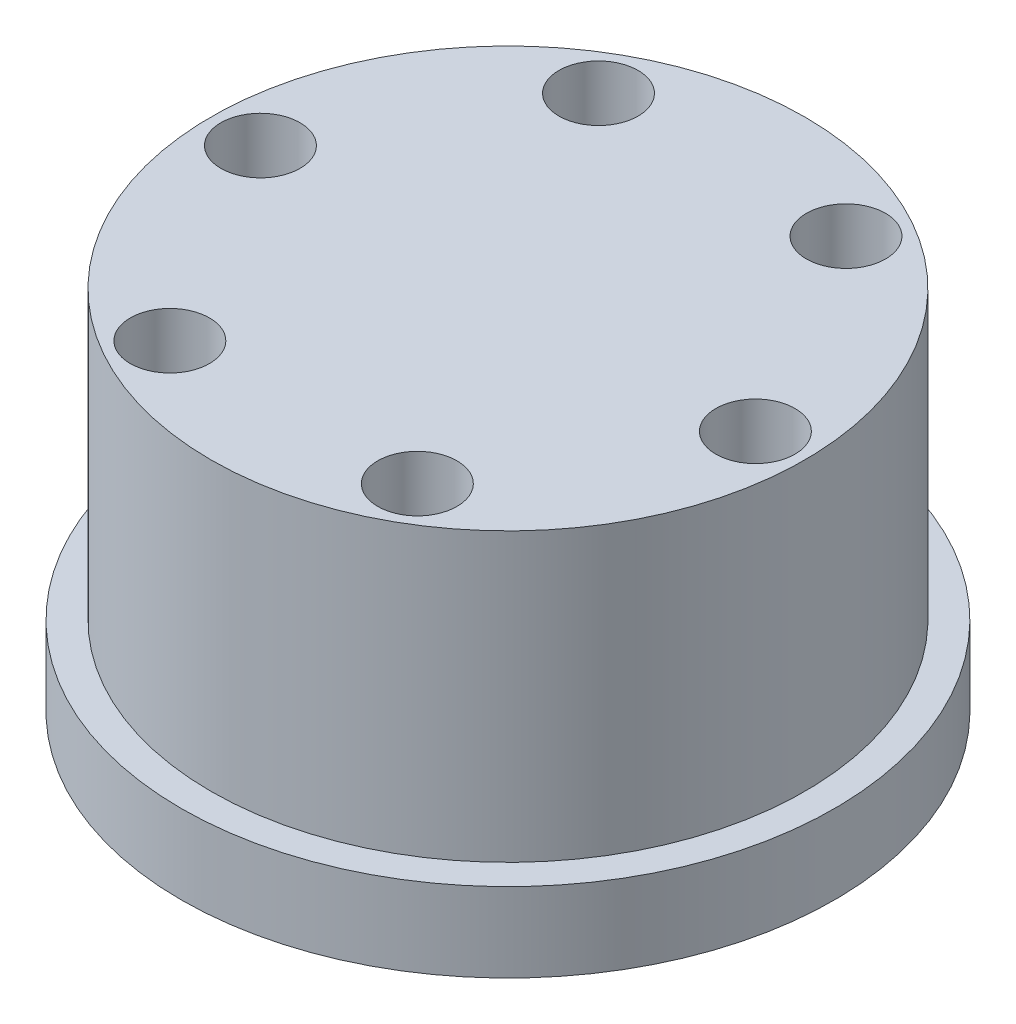
from build123d import *

# Parameters (mm, degrees)
SKETCH1_R           = 16.5
SKETCH1_R_2         = 1.5
BOSS_EXTRUDE1_DEPTH = 4
SKETCH2_R           = 15
BOSS_EXTRUDE2_DEPTH = 14.5
SKETCH5_R           = 2
CUT_EXTRUDE3_DEPTH  = 6.5
SKETCH6_R           = 7.5
CUT_EXTRUDE4_DEPTH  = 5


with BuildPart() as part:
    # Sketch1 → Boss-Extrude1 (new body)
    with BuildSketch(Plane(origin=(0, 0, 0), x_dir=(1, 0, 0), z_dir=(0, 1, 0))):
        Circle(SKETCH1_R)
        with Locations((0, 12.5)):
            Circle(SKETCH1_R_2, mode=Mode.SUBTRACT)
        with Locations((10.825317547, 6.25)):
            Circle(SKETCH1_R_2, mode=Mode.SUBTRACT)
        with Locations((10.825317547, -6.25)):
            Circle(SKETCH1_R_2, mode=Mode.SUBTRACT)
        with Locations((0, -12.5)):
            Circle(SKETCH1_R_2, mode=Mode.SUBTRACT)
        with Locations((-10.825317547, -6.25)):
            Circle(SKETCH1_R_2, mode=Mode.SUBTRACT)
        with Locations((-10.825317547, 6.25)):
            Circle(SKETCH1_R_2, mode=Mode.SUBTRACT)
    extrude(amount=BOSS_EXTRUDE1_DEPTH)

    # Sketch2 → Boss-Extrude2 (add)
    with BuildSketch(Plane(origin=(0, 4, 0), x_dir=(1, 0, 0), z_dir=(0, 1, 0))):
        Circle(SKETCH2_R)
    extrude(amount=BOSS_EXTRUDE2_DEPTH)

    # Sketch5 → Cut-Extrude3 (cut)
    with BuildSketch(Plane(origin=(0, 18.5, 0), x_dir=(1, 0, 0), z_dir=(0, 1, 0))):
        with Locations((-12.5, 0)):
            Circle(SKETCH5_R)
        with Locations((-6.25, 10.825317547)):
            Circle(SKETCH5_R)
        with Locations((6.25, 10.825317547)):
            Circle(SKETCH5_R)
        with Locations((12.5, 0)):
            Circle(SKETCH5_R)
        with Locations((6.25, -10.825317547)):
            Circle(SKETCH5_R)
        with Locations((-6.25, -10.825317547)):
            Circle(SKETCH5_R)
    extrude(amount=-CUT_EXTRUDE3_DEPTH, mode=Mode.SUBTRACT)

    # Sketch6 → Cut-Extrude4 (cut)
    with BuildSketch(Plane.XZ):
        Circle(SKETCH6_R)
    extrude(amount=-CUT_EXTRUDE4_DEPTH, mode=Mode.SUBTRACT)


solid = part.part
